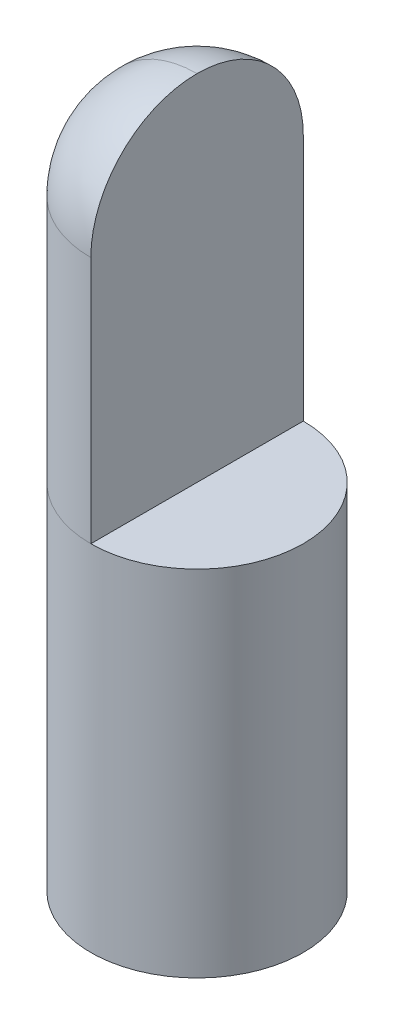
from build123d import *

# Parameters (mm, degrees)
SKETCH_1_W      = 30
SKETCH_1_H      = 100
SKETCH_2_W      = 30
SKETCH_2_H      = 60
EXTRUDE_1_DEPTH = 100
FILLET_1_R      = 30


with BuildPart() as part:
    # Эскиз1 → Повернуть1 (revolve)
    with BuildSketch(Plane.XY, mode=Mode.PRIVATE) as revolve_1_sk:
        with Locations((-15, 50)):
            Rectangle(SKETCH_1_W, SKETCH_1_H)
    revolve(revolve_1_sk.sketch.rotate(Axis((0, 0, 0), (0, 1, 0)), 270), axis=Axis((0, 0, 0), (0, 1, 0)))

    # Эскиз2 → Бобышка-Вытянуть1 (add)
    with BuildSketch(Plane(origin=(0, 100, 0), x_dir=(1, 0, 0), z_dir=(0, 1, 0))):
        with Locations((-15, 0)):
            Rectangle(SKETCH_2_W, SKETCH_2_H)
    extrude(amount=EXTRUDE_1_DEPTH)

    # Скругление1
    fillet_1_edges = [part.edges().sort_by_distance(p)[0] for p in [
        (-30, 150, -30),
    ]]
    fillet(fillet_1_edges, radius=FILLET_1_R - 0.0001)  # a hair under: the kernel refuses the full size
    fillet_1_2_edges = [part.edges().sort_by_distance(p)[0] for p in [
        (-30, 150, 30),
    ]]
    fillet(fillet_1_2_edges, radius=FILLET_1_R - 0.0001)  # a hair under: the kernel refuses the full size
    fillet_1_3_edges = [part.edges().sort_by_distance(p)[0] for p in [
        (-30, 200, 0),
    ]]
    fillet(fillet_1_3_edges, radius=FILLET_1_R - 0.0001)  # a hair under: the kernel refuses the full size


solid = part.part
